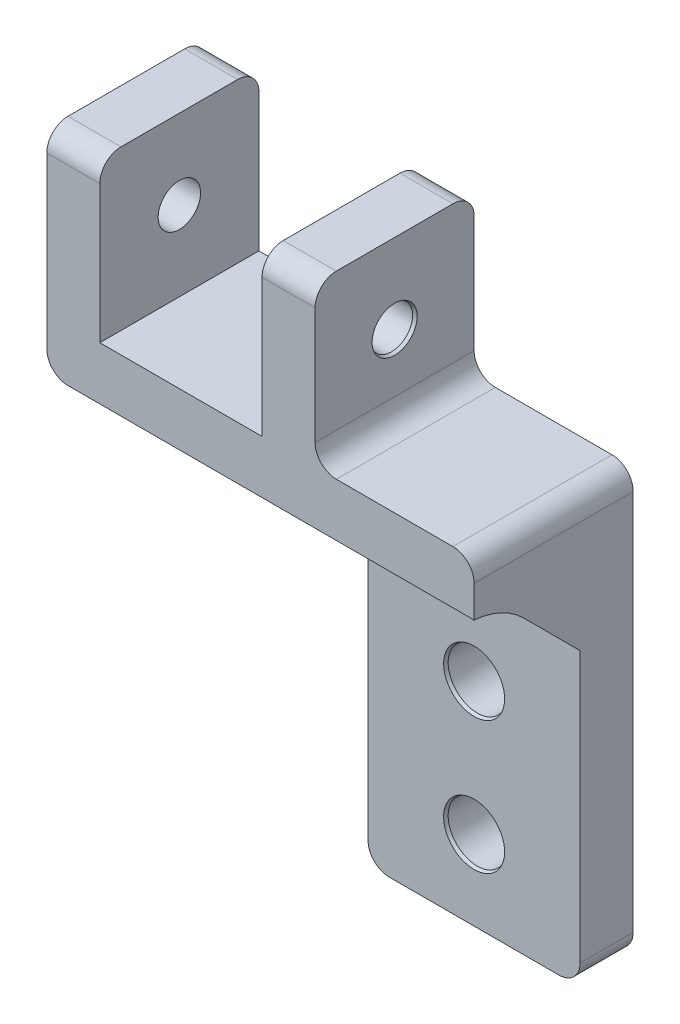
from build123d import *

# Parameters (mm, degrees)
SKETCH1_W                           = 10
SKETCH1_H                           = 5
SKETCH1_W_2                         = 5
SKETCH1_H_2                         = 40
BOSS_EXTRUDE1_DEPTH                 = 20
SKETCH3_W                           = 15
SKETCH3_H                           = 5
BOSS_EXTRUDE2_DEPTH                 = 20.3
CHAMFER2_SIZE                       = 7.5
SKETCH4_W                           = 5
SKETCH4_H                           = 15
BOSS_EXTRUDE3_DEPTH                 = 15
FILLET1_R                           = 7.5
F_5_5_5_5_DIAMETER_HOLE1_AT_2_COUNT = 2
F_5_5_5_5_DIAMETER_HOLE1_AT_2_PITCH = 12.5
FILLET2_R                           = 2


with BuildPart() as part:
    # Sketch1 → Boss-Extrude1 (new body)
    with BuildSketch(Plane(origin=(0, 0, 0), x_dir=(0, 0, -1), z_dir=(1, 0, 0))):
        with Locations((-5, 17.5)):
            Rectangle(SKETCH1_W, SKETCH1_H)
        with Locations((2.5, 0)):
            Rectangle(SKETCH1_W_2, SKETCH1_H_2)
    extrude(amount=BOSS_EXTRUDE1_DEPTH)

    # Sketch3 → Boss-Extrude2 (add)
    with BuildSketch(Plane(origin=(0, 0, 0), x_dir=(0, 0, -1), z_dir=(1, 0, 0))):
        with Locations((-2.5, 17.5)):
            Rectangle(SKETCH3_W, SKETCH3_H)
    extrude(amount=-BOSS_EXTRUDE2_DEPTH)

    # Chamfer2
    chamfer2_edges = [part.edges().sort_by_distance(p)[0] for p in [
        (10, 15, 0),
    ]]
    chamfer(chamfer2_edges, length=CHAMFER2_SIZE)

    # Sketch4 → Boss-Extrude3 (add)
    with BuildSketch(Plane(origin=(0, 20, 0), x_dir=(1, 0, 0), z_dir=(0, 1, 0))):
        with Locations((-17.8, -2.5)):
            Rectangle(SKETCH4_W, SKETCH4_H)
        with Locations((2.5, -2.5)):
            Rectangle(SKETCH4_W, SKETCH4_H)
    extrude(amount=BOSS_EXTRUDE3_DEPTH)

    # Fillet1
    # the kernel refuses this fillet: 7.5 mm, written as the material it adds along each edge
    with BuildSketch(Plane(origin=(0, 15, 7.5), x_dir=(0, -0.7071067811865472, -0.7071067811865479), z_dir=(1, 0, 0))) as fillet1_piece_1:
        with BuildLine():
            CenterArc((3.068709481, -7.5), FILLET1_R, 90, 40.155443777)
            Line((-1.767766953, -1.767766953), (0, 0))
            Line((0, 0), (3.068709481, 0))
        make_face()
    extrude(amount=20)
    with BuildSketch(Plane(origin=(0, 15, -5), x_dir=(0, -1, 0), z_dir=(0, 0, 1))) as fillet1_piece_2_section:
        with BuildLine():
            CenterArc((FILLET1_R, -FILLET1_R), FILLET1_R, 90, 90)
            Line((0, -FILLET1_R), (0, 0))
            Line((0, 0), (FILLET1_R, 0))
        make_face()
    fillet1_piece_2 = extrude(amount=31.25, mode=Mode.PRIVATE)
    fillet1_piece_2 = split(fillet1_piece_2, bisect_by=Plane(origin=(0, 8.75, 1.25), z_dir=(0, 0.7071067811865477, -0.7071067811865474)), keep=Keep.TOP, mode=Mode.PRIVATE)
    add(fillet1_piece_2)
    with BuildSketch(Plane(origin=(0, 15, -5), x_dir=(0, -1, 0), z_dir=(0, 0, 1))) as fillet1_piece_3a_section:
        with BuildLine():
            CenterArc((FILLET1_R, -FILLET1_R), FILLET1_R, 90, 90)
            Line((0, -FILLET1_R), (0, 0))
            Line((0, 0), (FILLET1_R, 0))
        make_face()
    fillet1_piece_3a = extrude(amount=31.25, mode=Mode.PRIVATE)
    fillet1_piece_3a = split(fillet1_piece_3a, bisect_by=Plane(origin=(0, 15, 10), z_dir=(0, 0, -1)), keep=Keep.TOP, mode=Mode.PRIVATE)
    fillet1_piece_3a = split(fillet1_piece_3a, bisect_by=Plane(origin=(0, 8.75, 1.25), z_dir=(0, -0.7071067811865477, 0.7071067811865474)), keep=Keep.TOP, mode=Mode.PRIVATE)
    with BuildSketch(Plane(origin=(-7.671773702, 15, 7.5), x_dir=(0, -0.7071067811865472, -0.7071067811865479), z_dir=(1, 0, 0))) as fillet1_piece_3b_section:
        with BuildLine():
            CenterArc((3.068709481, -7.5), FILLET1_R, 90, 40.155443777)
            Line((-1.767766953, -1.767766953), (0, 0))
            Line((0, 0), (3.068709481, 0))
        make_face()
    fillet1_piece_3b = extrude(amount=27.671773702, mode=Mode.PRIVATE)
    fillet1_piece_3b = split(fillet1_piece_3b, bisect_by=Plane(origin=(0, 15, 7.5), z_dir=(-1, 0, 0)), keep=Keep.TOP, mode=Mode.PRIVATE)
    fillet1_piece_3 = fillet1_piece_3a & fillet1_piece_3b
    add(fillet1_piece_3)

    # Sketch9 → Ø5.5 (5.5) Diameter Hole1 (revolve, cut)
    with BuildSketch(Plane(origin=(10, 0, 0), x_dir=(0, -1, 0), z_dir=(1, 0, 0))):
        Polygon((0, 0), (0, 5), (2.75, 5), (2.75, 0.301776695), (2.875, 0), align=None)
    f_5_5_5_5_diameter_hole1 = revolve(axis=Axis((10, 0, 6.35), (0, 0, -1)), mode=Mode.SUBTRACT)

    # Ø5.5 (5.5) Diameter Hole1 at 2: Ø5.5 (5.5) Diameter Hole1 ×2
    with Locations(*[(0, -i * F_5_5_5_5_DIAMETER_HOLE1_AT_2_PITCH, 0) for i in range(1, F_5_5_5_5_DIAMETER_HOLE1_AT_2_COUNT)]):
        add(f_5_5_5_5_diameter_hole1, mode=Mode.SUBTRACT)

    # Sketch12 → Ø4.0 (4) Diameter Hole1 (revolve, cut)
    with BuildSketch(Plane(origin=(-20.3, 27.5, 2.5), x_dir=(0, 0, 1), z_dir=(0, 1, 0))):
        Polygon((0, 0), (0, 5), (2, 5), (2, 0.301776695), (2.125, 0), align=None)
    f_4_0_4_diameter_hole1 = revolve(axis=Axis((-26.65, 27.5, 2.5), (1, 0, 0)), mode=Mode.SUBTRACT)

    # Mirror1: Ø4.0 (4) Diameter Hole1 across plane
    add(f_4_0_4_diameter_hole1.mirror(Plane(origin=(-7.65, 0, 0), x_dir=(0, 0, 1), z_dir=(1, 0, 0))), mode=Mode.SUBTRACT)

    # Fillet2
    fillet2_edges = [part.edges().sort_by_distance(p)[0] for p in [
        (20, -20, -2.5),
        (-20.3, 15, 2.5),
        (20, 20, 2.5),
        (-17.8, 35, -5),
        (-17.8, 35, 10),
        (5, 20, 2.5),
        (2.5, 35, 10),
        (2.5, 35, -5),
        (0, -20, -2.5),
    ]]
    fillet(fillet2_edges, radius=FILLET2_R)


solid = part.part
